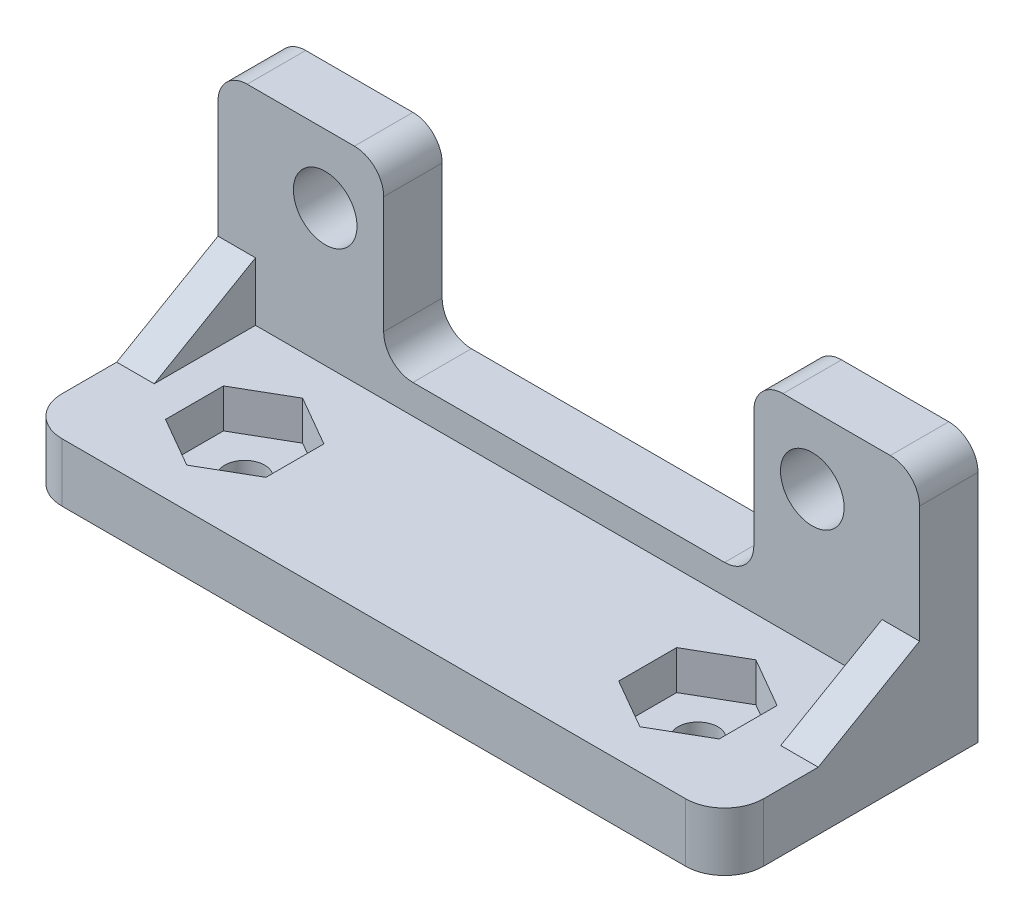
from build123d import *

# Parameters (mm, degrees)
BOSS_EXTRUDE1_DEPTH      = 3
SKETCH2_W                = 35.99
SKETCH2_H                = 3
BOSS_EXTRUDE2_DEPTH      = 13
F_4_CLEARANCE_HOLE1_D    = 3.2639
M2_5X0_45_TAPPED_HOLE1_D = 2.05
CUT_EXTRUDE1_DEPTH       = 25.557484093
CUT_EXTRUDE1_DEPTH_BACK  = 2
FILLET1_R                = 2
RIB1_REACH               = 41.551
SKETCH8_WALL_W           = 87.101962048
SKETCH8_WALL_H           = 1.925
FILLET2_R                = 1.5


with BuildPart() as part:
    # Sketch1 → Boss-Extrude1 (new body)
    with BuildSketch(Plane.XY):
        Polygon((-17.995, 0), (-17.995, -10), (17.995, -10), (17.995, 0), (17.995, 3.5), (9.495, 3.5), (9.495, 0), (9.495, -5.5), (-9.495, -5.5), (-9.495, 0), (-9.495, 3.5), (-17.995, 3.5), align=None)
    extrude(amount=BOSS_EXTRUDE1_DEPTH)

    # Sketch2 → Boss-Extrude2 (add)
    with BuildSketch(Plane.XY):
        with Locations((0, -8.5)):
            Rectangle(SKETCH2_W, SKETCH2_H)
    extrude(amount=BOSS_EXTRUDE2_DEPTH)

    # #4 Clearance Hole1 (through all)
    with Locations(Plane(origin=(0, 0, 0), x_dir=(-1, 0, 0), z_dir=(0, 0, -1))):
        with Locations((12.495, 0), (-12.495, 0)):
            Hole(F_4_CLEARANCE_HOLE1_D / 2)

    # M2.5x0.45 Tapped Hole1 (through all)
    with Locations(Plane(origin=(0, -7, 0), x_dir=(1, 0, 0), z_dir=(0, 1, 0))):
        with Locations((-11.625, -8), (11.625, -8)):
            Hole(M2_5X0_45_TAPPED_HOLE1_D / 2)

    # Sketch9 → Cut-Extrude1 (cut, two sides: drawn at the far end of the back side and taken through both)
    with BuildSketch(Plane(origin=(0, -7, 0), x_dir=(1, 0, 0), z_dir=(0, 1, 0)).offset(-CUT_EXTRUDE1_DEPTH_BACK)):
        Polygon((-9.05, -6.513323057), (-11.625, -5.026646114), (-14.2, -6.513323057), (-14.2, -9.486676943), (-11.625, -10.973353886), (-9.05, -9.486676943), align=None)
        Polygon((11.625, -5.026646114), (9.05, -6.513323057), (9.05, -9.486676943), (11.625, -10.973353886), (14.2, -9.486676943), (14.2, -6.513323057), align=None)
    extrude(amount=CUT_EXTRUDE1_DEPTH + CUT_EXTRUDE1_DEPTH_BACK, mode=Mode.SUBTRACT)

    # Fillet1
    fillet1_edges = [part.edges().sort_by_distance(p)[0] for p in [
        (17.995, -8.5, 13),
        (-17.995, -8.5, 13),
    ]]
    fillet(fillet1_edges, radius=FILLET1_R)

    # Sketch8 wall → Rib1 (add, up to next)
    with BuildSketch(Plane(origin=(-17.995, -5.5, 5.598076211), x_dir=(0, -0.499999999979, 0.866025403797), z_dir=(0, 0.866025403797, 0.499999999979)), mode=Mode.PRIVATE) as rib1_sk1:
        with Locations((0, 0.9625)):
            Rectangle(SKETCH8_WALL_W, SKETCH8_WALL_H)
    rib1_tool1 = extrude(rib1_sk1.sketch, amount=-RIB1_REACH, mode=Mode.PRIVATE) - part.part
    rib1 = rib1_tool1.solids().sort_by_distance((-17.995, -5.5, 5.598076211))[0]
    add(rib1)

    # Mirror1: Rib1 across plane
    add(rib1.mirror(Plane(origin=(0, 0, 0), x_dir=(0, 0, 1), z_dir=(1, 0, 0))))

    # Fillet2
    fillet2_edges = [part.edges().sort_by_distance(p)[0] for p in [
        (17.995, 3.5, 1.5),
        (9.495, 3.5, 1.5),
        (9.495, -5.5, 1.5),
        (-17.995, 3.5, 1.5),
        (-9.495, 3.5, 1.5),
        (-9.495, -5.5, 1.5),
    ]]
    fillet(fillet2_edges, radius=FILLET2_R)


solid = part.part
